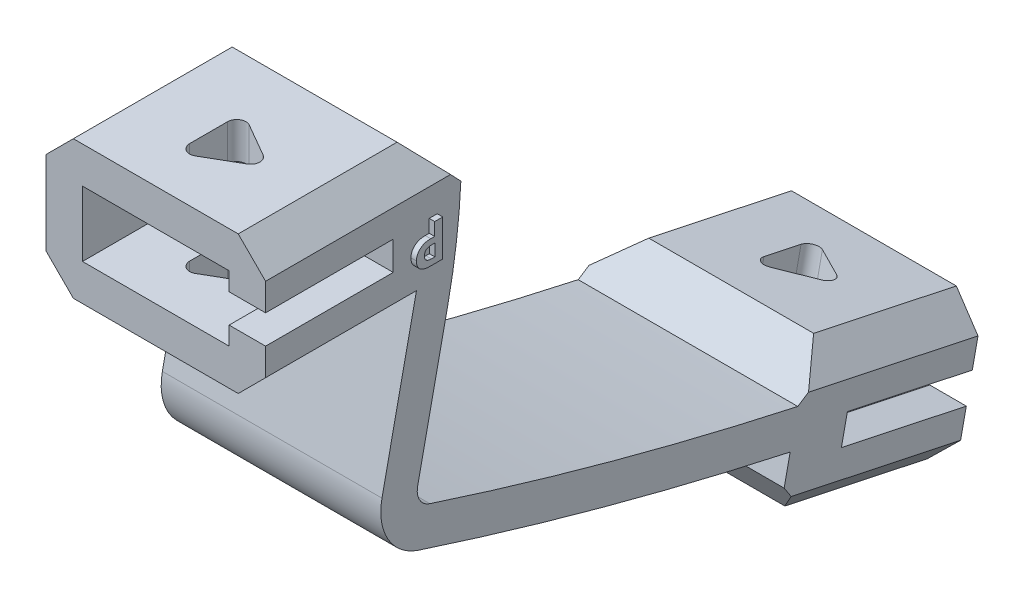
from build123d import *

# Parameters (mm, degrees)
SKETCH1_W                      = 12.04
SKETCH1_H                      = 7.58
SKETCH1_W_2                    = 8.04
SKETCH1_H_2                    = 3.58
BOSS_EXTRUDE1_DEPTH            = 8
SKETCH1_2_W                    = 12.04
SKETCH1_2_H                    = 7.58
SKETCH1_2_W_2                  = 8.04
SKETCH1_2_H_2                  = 3.58
BOSS_EXTRUDE2_DEPTH            = 2
EXTRUDE_THIN1_DEPTH            = 12.04
SKETCH5_W                      = 12.04
SKETCH5_H                      = 7.58
SKETCH5_W_2                    = 8.04
SKETCH5_H_2                    = 3.58
BOSS_EXTRUDE4_DEPTH            = 8
SKETCH5_4_W                    = 12.04
SKETCH5_4_H                    = 7.58
BOSS_EXTRUDE5_DEPTH            = 2
CHAMFER1_SIZE                  = 1.5
CHAMFER2_START                 = -7
CHAMFER2_DEPTH                 = 14
CUT_EXTRUDE1_REACH             = 45.534
CUT_EXTRUDE1_DIRECTION_2_DEPTH = 44.534029429
CUT_EXTRUDE2_DEPTH             = 43.263143381
CUT_EXTRUDE2_DEPTH_BACK        = 43.263143381
SKETCH8_W                      = 2
SKETCH8_H                      = 1.58
CUT_EXTRUDE3_DEPTH             = 7
SKETCH9_W                      = 4
SKETCH9_H                      = 1.58
CUT_EXTRUDE4_DEPTH             = 7
BOSS_EXTRUDE7_DEPTH            = 0.3


with BuildPart() as part:
    # Sketch1 → Boss-Extrude1 (new body)
    with BuildSketch(Plane.XY):
        Rectangle(SKETCH1_W, SKETCH1_H)
        Rectangle(SKETCH1_W_2, SKETCH1_H_2, mode=Mode.SUBTRACT)
    extrude(amount=BOSS_EXTRUDE1_DEPTH)

    # Sketch1<2> → Boss-Extrude2 (add)
    # profile 1 of 2: a face of its own
    with BuildSketch(Plane.XY):
        Rectangle(SKETCH1_2_W, SKETCH1_2_H)
        Rectangle(SKETCH1_2_W_2, SKETCH1_2_H_2, mode=Mode.SUBTRACT)
    # profile 2 of 2: a face of its own
    with BuildSketch(Plane.XY):
        Rectangle(SKETCH1_2_W_2, SKETCH1_2_H_2)
    extrude(amount=-BOSS_EXTRUDE2_DEPTH)

    # Sketch3 → Extrude-Thin1 (add)
    with BuildSketch(Plane(origin=(6.02, 9.81, 0), x_dir=(0, -1, 0), z_dir=(1, 0, 0))):
        with BuildLine():
            Line((6.02, 2.744137986), (6.52, 2.744137986))
            ThreePointArc((6.52, 2.744137986), (10.07949931, 2.557592532), (13.6, 2))
            Line((13.6, 2), (21.425180806, 0.336706473))
            ThreePointArc((21.425180806, 0.336706473), (22.132801564, 0.448660765), (22.583941196, 1.005198215))
            ThreePointArc((22.583941196, 1.005198215), (25.714510404, 11.554301253), (28.285098031, 22.253652529))
            Line((28.285098031, 22.253652529), (28.472176136, 23.133785819))
            Line((28.472176136, 23.133785819), (30.428471338, 22.717962437))
            Line((30.428471338, 22.717962437), (30.241393232, 21.837829148))
            ThreePointArc((30.241393232, 21.837829148), (27.646188069, 11.036014268), (24.485638594, 0.385886497))
            ThreePointArc((24.485638594, 0.385886497), (23.132219698, -1.283725852), (21.009357424, -1.619588728))
            Line((21.009357424, -1.619588728), (13.184176618, 0.043704799))
            ThreePointArc((13.184176618, 0.043704799), (9.870442383, 0.568548741), (6.52, 0.744137986))
            Line((6.52, 0.744137986), (6.02, 0.744137986))
            Line((6.02, 0.744137986), (6.02, 2.744137986))
        make_face()
    extrude(amount=-EXTRUDE_THIN1_DEPTH)



with BuildPart() as body_2:
    # Sketch5 → Boss-Extrude4 (new body)
    with BuildSketch(Plane(origin=(0, 485.418561105, -130.279454131), x_dir=(1, 0, 0), z_dir=(0, -0.20791169081775487, -0.9781476007338067))):
        with Locations((0, 517.132200771)):
            Rectangle(SKETCH5_W, SKETCH5_H)
        with Locations((0, 517.132200771)):
            Rectangle(SKETCH5_W_2, SKETCH5_H_2, mode=Mode.SUBTRACT)
    extrude(amount=BOSS_EXTRUDE4_DEPTH)


with BuildPart() as part_1:
    add(part.part)

    add(body_2.part)  # Boss-Extrude5 merges body 2
    # Sketch5<4> → Boss-Extrude5 (add)
    with BuildSketch(Plane(origin=(0, 485.418561105, -130.279454131), x_dir=(1, 0, 0), z_dir=(0, -0.20791169081775487, -0.9781476007338067))):
        with Locations((0, 517.132200771)):
            Rectangle(SKETCH5_4_W, SKETCH5_4_H)
    extrude(amount=-BOSS_EXTRUDE5_DEPTH)

    # Chamfer1
    chamfer1_edges = [part_1.edges().sort_by_distance(p)[0] for p in [
        (6.02, -24.743974821, -24.908081386),
        (-6.02, -24.743974821, -24.908081386),
        (6.02, 3.79, 2.627931007),
        (6.02, -3.79, 4.022340595),
        (-6.02, -3.79, 4.022340595),
        (-6.02, 3.79, 2.627931007),
        (6.02, -17.329616007, -26.484052003),
        (-6.02, -17.329616007, -26.484052003),
    ]]
    chamfer(chamfer1_edges, length=CHAMFER1_SIZE)

    # Chamfer2: read off the stored shape, not the designer's step
    # Chamfer2 outline → Chamfer2 (cut)
    with BuildSketch(Plane.YZ.offset(CHAMFER2_START)):
        with BuildLine():
            Line((3.79, -2.744137986), (3.79, -0.709020541))
            Line((3.79, -0.709020541), (1.696404781, -2.706829325))
            ThreePointArc((1.696404781, -2.706829325), (2.492984056, -2.734809543), (3.29, -2.744137986))
            Line((3.29, -2.744137986), (3.79, -2.744137986))
        make_face()
        Polygon((-23.704416367, -20.017343383), (-24.120239749, -21.973638584), (-21.748121165, -20.433166764), align=None)
        with BuildLine():
            ThreePointArc((-18.243518062, -21.17809315), (-18.243825174, -21.1795015), (-18.244132277, -21.180909853))
            Line((-18.244132277, -21.180909853), (-16.705880935, -23.549609201))
            Line((-16.705880935, -23.549609201), (-16.290057553, -21.593313999))
            Line((-16.290057553, -21.593313999), (-18.243518062, -21.17809315))
        make_face()
    extrude(amount=CHAMFER2_DEPTH, mode=Mode.SUBTRACT)

    # Cut-Extrude1: up to this face of the body (flat: up to its plane)
    cut_extrude1_end = Plane(part_1.part.faces().sort_by_distance((0, -3.79, 4.022340595))[0])
    # Sketch6 → Cut-Extrude1 (cut, up to the picked face)
    with BuildSketch(Plane(origin=(0, 3.79, 0), x_dir=(1, 0, 0), z_dir=(0, 1, 0)), mode=Mode.PRIVATE) as cut_extrude1_sk1:
        with BuildLine():
            Line((1.45, -3.566987298), (-0.35, -2.527756814))
            ThreePointArc((-0.35, -2.527756814), (-0.85, -2.527756814), (-1.1, -2.960769515))
            Line((-1.1, -2.960769515), (-1.1, -5.039230485))
            ThreePointArc((-1.1, -5.039230485), (-0.85, -5.472243186), (-0.35, -5.472243186))
            Line((-0.35, -5.472243186), (1.45, -4.433012702))
            ThreePointArc((1.45, -4.433012702), (1.7, -4), (1.45, -3.566987298))
        make_face()
    cut_extrude1_tool1 = split(extrude(cut_extrude1_sk1.sketch, amount=-CUT_EXTRUDE1_REACH, mode=Mode.PRIVATE), bisect_by=cut_extrude1_end, keep=Keep.BOTH, mode=Mode.PRIVATE)
    add(cut_extrude1_tool1.solids().sort_by(Axis((0, 3.79, 4), (0, -1, 0)))[0], mode=Mode.SUBTRACT)

    # Sketch6 → Cut-Extrude1 direction 2 (cut)
    with BuildSketch(Plane(origin=(0, 3.79, 0), x_dir=(1, 0, 0), z_dir=(0, 1, 0))):
        with BuildLine():
            Line((1.45, -3.566987298), (-0.35, -2.527756814))
            ThreePointArc((-0.35, -2.527756814), (-0.85, -2.527756814), (-1.1, -2.960769515))
            Line((-1.1, -2.960769515), (-1.1, -5.039230485))
            ThreePointArc((-1.1, -5.039230485), (-0.85, -5.472243186), (-0.35, -5.472243186))
            Line((-0.35, -5.472243186), (1.45, -4.433012702))
            ThreePointArc((1.45, -4.433012702), (1.7, -4), (1.45, -3.566987298))
        make_face()
    extrude(amount=CUT_EXTRUDE1_DIRECTION_2_DEPTH, mode=Mode.SUBTRACT)

    # Sketch7 → Cut-Extrude2 (cut, two sides: drawn at the far end of the back side and taken through both)
    with BuildSketch(Plane(origin=(0, -18.608845607, 3.955432239), x_dir=(1, 0, 0), z_dir=(0, -0.9781476007338067, 0.2079116908177549)).offset(-CUT_EXTRUDE2_DEPTH_BACK)):
        with BuildLine():
            Line((1.45, -30.075328988), (-0.35, -29.036098503))
            ThreePointArc((-0.35, -29.036098503), (-0.85, -29.036098503), (-1.1, -29.469111205))
            Line((-1.1, -29.469111205), (-1.1, -31.547572174))
            ThreePointArc((-1.1, -31.547572174), (-0.85, -31.980584876), (-0.35, -31.980584876))
            Line((-0.35, -31.980584876), (1.45, -30.941354391))
            ThreePointArc((1.45, -30.941354391), (1.7, -30.508341689), (1.45, -30.075328988))
        make_face()
    extrude(amount=CUT_EXTRUDE2_DEPTH + CUT_EXTRUDE2_DEPTH_BACK, mode=Mode.SUBTRACT)

    # Sketch8 → Cut-Extrude3 (cut)
    with BuildSketch(Plane.XY.offset(8)):
        with Locations((5.02, 0)):
            Rectangle(SKETCH8_W, SKETCH8_H)
    extrude(amount=-CUT_EXTRUDE3_DEPTH, mode=Mode.SUBTRACT)

    # Sketch9 → Cut-Extrude4 (cut)
    with BuildSketch(Plane(origin=(0, -7.174687668, -33.754251629), x_dir=(-1, 0, 0), z_dir=(0, -0.20791169081775673, -0.9781476007338064))):
        with Locations((-6.02, -15.234578288)):
            Rectangle(SKETCH9_W, SKETCH9_H)
    extrude(amount=-CUT_EXTRUDE4_DEPTH, mode=Mode.SUBTRACT)

    # Sketch11 → Boss-Extrude7 (add)
    with BuildSketch(Plane(origin=(6.02, 0, -6.02), x_dir=(0, 0, 1), z_dir=(-1, 0, 0))):
        with BuildLine():
            Line((5.047536003, 0.082682927), (5.047536003, 0.79))
            Line((5.047536003, 0.79), (4.608511613, 0.79))
            Line((4.608511613, 0.79), (4.608511613, -1.21))
            Line((4.608511613, -1.21), (5.299060394, -1.21))
            add(Edge.make_bspline(
                [(5.299060394, -1.21), (5.329313952, -1.209669089), (5.387892505, -1.20902836), (5.472763934, -1.201041655), (5.551912875, -1.189213366), (5.625349672, -1.172100798), (5.693083305, -1.150229064), (5.754766894, -1.122952683), (5.811034602, -1.091546463), (5.860787755, -1.054159212), (5.905113914, -1.0123961), (5.943543862, -0.965606031), (5.975708858, -0.913602215), (6.002058422, -0.856769543), (6.02273613, -0.795055664), (6.036919265, -0.728309994), (6.045834622, -0.656886984), (6.046958484, -0.607639268), (6.047536003, -0.582332317)],
                knots=[0, 0, 0, 0, 1.298309684, 2.513856393, 3.656108695, 4.731525363, 5.747269452, 6.706842141, 7.622696522, 8.50723259, 9.371308978, 10.231556582, 11.09863924, 11.989139744, 12.915198226, 13.88644584, 14.913906774, 16, 16, 16, 16], degree=3))
            add(Edge.make_bspline(
                [(6.047536003, -0.582332317), (6.046958026, -0.557515305), (6.045826057, -0.50891113), (6.034579341, -0.43810911), (6.01784318, -0.370657155), (5.992755465, -0.307388849), (5.96129274, -0.247554648), (5.922654871, -0.191755979), (5.876715772, -0.140008785), (5.824737087, -0.092263463), (5.76741001, -0.049357043), (5.705904977, -0.012393475), (5.640949178, 0.01871881), (5.572580865, 0.043912433), (5.500609023, 0.062967718), (5.425113901, 0.075859677), (5.346196751, 0.08276557), (5.2924674, 0.082710787), (5.265142711, 0.082682927)],
                knots=[0, 0, 0, 0, 1.030031435, 2.017318961, 2.9707634, 3.911434012, 4.836705747, 5.773461207, 6.723043161, 7.705184701, 8.700351159, 9.692154612, 10.681034209, 11.68770297, 12.714187277, 13.76904456, 14.865421547, 16, 16, 16, 16], degree=3))
            Line((5.265142711, 0.082682927), (5.047536003, 0.082682927))
        make_face()
        with BuildLine():
            Line((5.036103077, -0.892926829), (5.036103077, -0.234390244))
            Line((5.036103077, -0.234390244), (5.224746369, -0.234390244))
            add(Edge.make_bspline(
                [(5.224746369, -0.234390244), (5.240257069, -0.234519065), (5.270324289, -0.234768783), (5.313827436, -0.239266362), (5.354507641, -0.245501395), (5.39208054, -0.254654559), (5.426930993, -0.265974439), (5.458434732, -0.280437451), (5.487059955, -0.297407138), (5.512929634, -0.316804387), (5.535224382, -0.339455254), (5.555117628, -0.364216963), (5.571992729, -0.391655317), (5.585050634, -0.422099729), (5.596087863, -0.45462628), (5.602917978, -0.490012993), (5.607750907, -0.527828853), (5.608252881, -0.553986887), (5.608511613, -0.567469512)],
                knots=[0, 0, 0, 0, 1.278264899, 2.477894098, 3.602370215, 4.669373304, 5.663063542, 6.619223296, 7.520996807, 8.402964925, 9.276935434, 10.134111266, 11.017943356, 11.922995833, 12.86038281, 13.844364746, 14.88892179, 16, 16, 16, 16], degree=3))
            add(Edge.make_bspline(
                [(5.608511613, -0.567469512), (5.608243066, -0.580569264), (5.607719879, -0.606090356), (5.602979451, -0.643045607), (5.595872643, -0.677668866), (5.585733194, -0.709706236), (5.572188175, -0.739091862), (5.555687516, -0.765952955), (5.536368124, -0.790420284), (5.513666923, -0.811964985), (5.488692805, -0.831640584), (5.459986472, -0.847894241), (5.428669687, -0.862115985), (5.394268426, -0.873426519), (5.357002183, -0.882096268), (5.316907649, -0.888585203), (5.273728574, -0.892402235), (5.243936115, -0.892748228), (5.228557345, -0.892926829)],
                knots=[0, 0, 0, 0, 1.096807385, 2.136813243, 3.115574441, 4.054422268, 4.94474187, 5.818891163, 6.689666352, 7.547538513, 8.435055958, 9.345744162, 10.302983784, 11.312439221, 12.373194966, 13.505006157, 14.712092391, 16, 16, 16, 16], degree=3))
            Line((5.228557345, -0.892926829), (5.036103077, -0.892926829))
        make_face(mode=Mode.SUBTRACT)
    extrude(amount=-BOSS_EXTRUDE7_DEPTH)


solid = part_1.part
